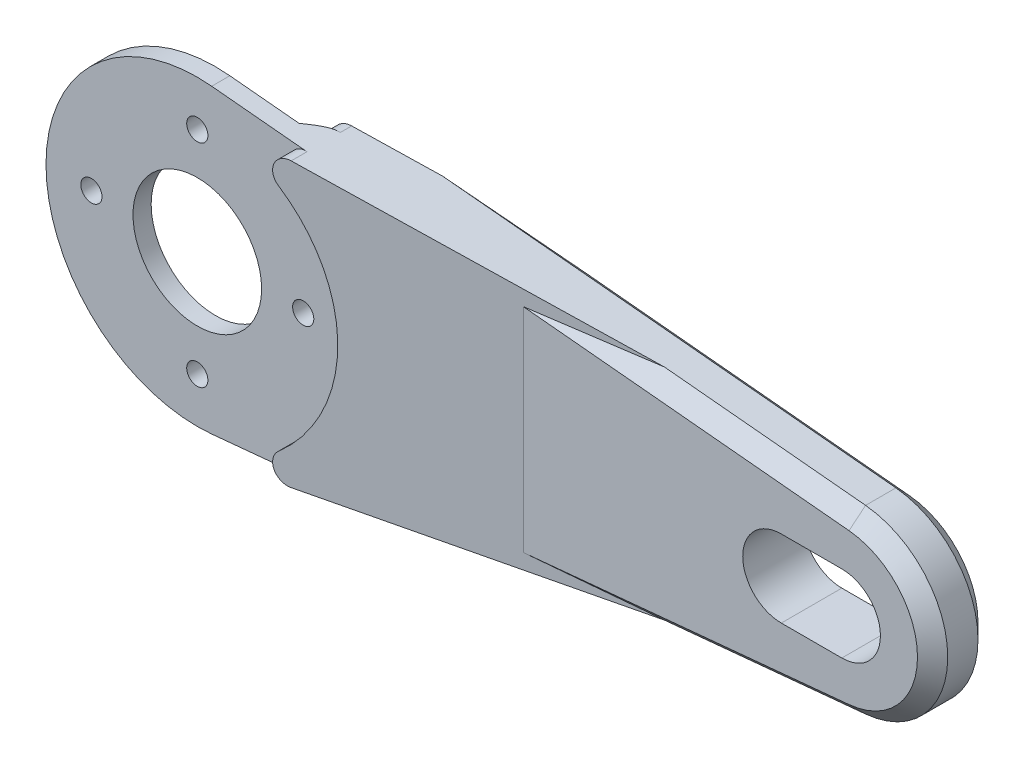
from build123d import *

# Parameters (mm, degrees)
EXTRUDE_1_DEPTH          = 4
CUT_EXTRUDE_1_DEPTH      = 50.678969393496885
SKETCH_5_R               = 10
CUT_EXTRUDE_2_DEPTH      = 3.4
SKETCH_6_R               = 0.7
SKETCH_6_R_2             = 0.7000000000000005
CUT_EXTRUDE_3_DEPTH      = 50.24591353604885
SKETCH_8_R               = 4.25
CUT_EXTRUDE_5_DEPTH      = 50.24591353604885
CUT_EXTRUDE_7_DEPTH      = 50.193495504995376
CUT_EXTRUDE_7_DEPTH_BACK = 50.193495504995376
FILLET_1_R               = 1
CHAMFER_1_SIZE           = 1
CHAMFER_3_SIZE           = 1


with BuildPart() as part:
    # 草图1 → 凸台-拉伸1 (new, symmetric)
    with BuildSketch(Plane.XY):
        with BuildLine():
            Line((0.9523809523809523, 9.954545219222322), (42.57142857142857, 5.972727131533395))
            ThreePointArc((42.57142857142857, 5.972727131533395), (48, 0), (42.57142857142857, -5.972727131533395))
            Line((42.57142857142857, -5.972727131533395), (0.9523809523809523, -9.954545219222322))
            ThreePointArc((0.9523809523809523, -9.954545219222322), (-10.000000000000002, 1.22e-15), (0.9523809523809523, 9.954545219222322))
        make_face()
    extrude(amount=EXTRUDE_1_DEPTH, both=True)

    # 草图3 → 切除-拉伸1 (cut, through all)
    with BuildSketch(Plane.XY.offset(4)):
        with BuildLine():
            Line((38, 2.55), (42, 2.55))
            ThreePointArc((42, 2.55), (44.55, 0), (42, -2.55))
            Line((42, -2.55), (38, -2.55))
            ThreePointArc((38, -2.55), (35.45, 3.1e-16), (38, 2.55))
        make_face()
    extrude(amount=-CUT_EXTRUDE_1_DEPTH, mode=Mode.SUBTRACT)

    # 草图5 → 切除-拉伸2 (cut)
    with BuildSketch(Plane.XY.offset(4)):
        Circle(SKETCH_5_R)
    cut_extrude_2 = extrude(amount=-CUT_EXTRUDE_2_DEPTH, mode=Mode.SUBTRACT)

    # 镜向7: 切除-拉伸2 across plane
    add(cut_extrude_2.mirror(Plane.XY), mode=Mode.SUBTRACT)

    # 草图6 → 切除-拉伸3 (cut, through all)
    with BuildSketch(Plane.XY.offset(0.6000000000000003)):
        with Locations((0, 7)):
            Circle(SKETCH_6_R)
        with Locations((0, -7)):
            Circle(SKETCH_6_R)
        with Locations((7, -1.8e-15)):
            Circle(SKETCH_6_R_2)
        with Locations((-7, -1.8e-15)):
            Circle(SKETCH_6_R_2)
    extrude(amount=-CUT_EXTRUDE_3_DEPTH, mode=Mode.SUBTRACT)

    # 草图8 → 切除-拉伸5 (cut, through all)
    with BuildSketch(Plane.XY.offset(0.6000000000000003)):
        Circle(SKETCH_8_R)
    extrude(amount=-CUT_EXTRUDE_5_DEPTH, mode=Mode.SUBTRACT)

    # 草图10 → 切除-拉伸7 (cut, two sides: drawn at the far end of the back side and taken through both)
    with BuildSketch(Plane(origin=(0, 0, 0), x_dir=(1, 0, 0), z_dir=(0, 1, 0)).offset(-CUT_EXTRUDE_7_DEPTH_BACK)):
        Polygon((0.9523809523809523, 1.6000000000000003), (0.9523809523809523, 4), (20.952380952380953, 4.000000000000003), align=None)
        Polygon((0.9523809523809523, -2.4), (20.95238095238096, 6.07e-15), (48.00000000000001, 6.07e-15), (48.00000000000001, -4), (0.952380952380952, -4), align=None)
    extrude(amount=CUT_EXTRUDE_7_DEPTH + CUT_EXTRUDE_7_DEPTH_BACK, mode=Mode.SUBTRACT)

    # 圆角1
    fillet_1_edges = [part.edges().sort_by_distance(p)[0] for p in [
        (0.9523809523809526, 9.954545219222322, -1.0999999999999996),
        (0.9523809523809524, -9.954545219222322, -1.0999999999999996),
        (0.9523809523809526, 9.954545219222322, 1.5),
        (0.9523809523809524, -9.954545219222322, 1.5),
    ]]
    fillet(fillet_1_edges, radius=FILLET_1_R)

    # 倒角1
    chamfer_1_edges = [part.edges().sort_by_distance(p)[0] for p in [
        (31.761904761904763, 7.006906428907978, -4),
        (48, 1.33e-15, -4),
        (31.761904761904763, -7.006906428907978, -4),
        (48, 1.33e-15, -6.07e-15),
        (31.761904761904763, -7.006906428907977, -6.07e-15),
        (31.761904761904766, 7.006906428907978, -6.07e-15),
    ]]
    chamfer(chamfer_1_edges, length=CHAMFER_1_SIZE)

    # 倒角3
    # the kernel refuses this chamfer: 1 mm, written as the material it adds along each edge
    with BuildSketch(Plane(origin=(0, 0, -0.6000000000000001), x_dir=(0.6502681863563081, -0.7597047359421143, 0), z_dir=(-0.7597047359421143, -0.6502681863563081, 0))) as chamfer_3_piece_1:
        Polygon((10, -CHAMFER_3_SIZE), (9.999999999999998 - CHAMFER_3_SIZE, -2e-16), (9.999999999999998, 0), align=None)
    revolve(axis=Axis((0, 0, -0.6000000000000001), (0, 2e-17, 1)), revolution_arc=98.87634994501913)
    with BuildSketch(Plane(origin=(7.1529500499193945, 8.356752095363253, -0.6000000000000001), x_dir=(0.45453302112340566, -0.8907298876249914, 0), z_dir=(-0.8907298876249914, -0.45453302112340566, 0))) as chamfer_3_piece_2_section:
        Polygon((1.0000000000000004, -CHAMFER_3_SIZE), (1.0000000000000004 + CHAMFER_3_SIZE, 0), (1.0000000000000004, 0), align=None)
    chamfer_3_piece_2 = revolve(axis=Axis((7.1529500499193945, 8.356752095363253, -0.6000000000000001), (0, 0, 1)), revolution_arc=292.40328295994874, mode=Mode.PRIVATE)
    chamfer_3_piece_2 = split(chamfer_3_piece_2, bisect_by=Plane(origin=(6.105913725446883, 9.461491408882363, -0.9544569882762437), z_dir=(-0.09523809523809522, -0.995454521922232, 0)), keep=Keep.TOP, mode=Mode.PRIVATE)
    add(chamfer_3_piece_2)
    with BuildSketch(Plane(origin=(7.152950049919392, -8.356752095363255, -0.6000000000000001), x_dir=(0.4545330211234144, 0.8907298876249867, 0), z_dir=(-0.8907298876249867, 0.4545330211234144, 0))) as chamfer_3_piece_3_section:
        Polygon((1.0000000000000002 + CHAMFER_3_SIZE, 0), (0.9999999999999994, CHAMFER_3_SIZE), (1.0000000000000002, 0), align=None)
    chamfer_3_piece_3 = revolve(axis=Axis((7.152950049919392, -8.356752095363255, -0.6000000000000001), (0, 0, -1)), revolution_arc=292.40328295994846, mode=Mode.PRIVATE)
    chamfer_3_piece_3 = split(chamfer_3_piece_3, bisect_by=Plane(origin=(6.105912616149652, -9.46149151501213, -0.9544569410111913), z_dir=(-0.09523809523809522, 0.995454521922232, 0)), keep=Keep.TOP, mode=Mode.PRIVATE)
    add(chamfer_3_piece_3)


solid = part.part
